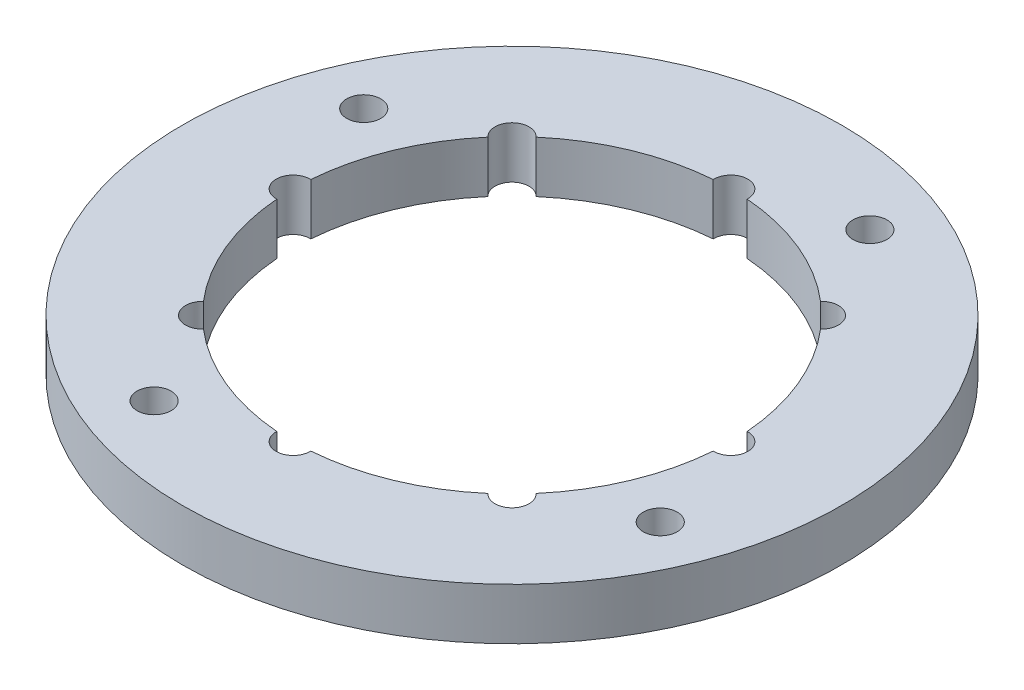
from build123d import *

# Parameters (mm, degrees)
F_1_5IN_SOCKET_R    = 40.64
F_1_5IN_SOCKET_R_2  = 2.1
BOSS_EXTRUDE1_DEPTH = 6.35


with BuildPart() as part:
    # 1.5in Socket → Boss-Extrude1 (new body)
    with BuildSketch(Plane(origin=(0, 0, 0), x_dir=(1, 0, 0), z_dir=(0, 1, 0))):
        Circle(F_1_5IN_SOCKET_R)
        with Locations((-12.927811712, -31.210498367)):
            Circle(F_1_5IN_SOCKET_R_2, mode=Mode.SUBTRACT)
        with BuildLine():
            ThreePointArc((-17.544892644, 20.506142942), (-10.327669131, 24.933198884), (-2.093920166, 26.906145294))
            ThreePointArc((-2.093920166, 26.906145294), (0, 29.083), (2.093920166, 26.906145294))
            ThreePointArc((2.093920166, 26.906145294), (10.327669131, 24.933198884), (17.544892644, 20.506142942))
            ThreePointArc((17.544892644, 20.506142942), (20.564786517, 20.564786517), (20.506142942, 17.544892644))
            ThreePointArc((20.506142942, 17.544892644), (24.933198884, 10.327669131), (26.906145294, 2.093920166))
            ThreePointArc((26.906145294, 2.093920166), (29.083, 0), (26.906145294, -2.093920166))
            ThreePointArc((26.906145294, -2.093920166), (24.933198884, -10.327669131), (20.506142942, -17.544892644))
            ThreePointArc((20.506142942, -17.544892644), (20.564786517, -20.564786517), (17.544892644, -20.506142942))
            ThreePointArc((17.544892644, -20.506142942), (10.327669131, -24.933198884), (2.093920166, -26.906145294))
            ThreePointArc((2.093920166, -26.906145294), (0, -29.083), (-2.093920166, -26.906145294))
            ThreePointArc((-2.093920166, -26.906145294), (-10.327669131, -24.933198884), (-17.544892644, -20.506142942))
            ThreePointArc((-17.544892644, -20.506142942), (-20.564786517, -20.564786517), (-20.506142942, -17.544892644))
            ThreePointArc((-20.506142942, -17.544892644), (-24.933198884, -10.327669131), (-26.906145294, -2.093920166))
            ThreePointArc((-26.906145294, -2.093920166), (-29.083, 0), (-26.906145294, 2.093920166))
            ThreePointArc((-26.906145294, 2.093920166), (-24.933198884, 10.327669131), (-20.506142942, 17.544892644))
            ThreePointArc((-20.506142942, 17.544892644), (-20.564786517, 20.564786517), (-17.544892644, 20.506142942))
        make_face(mode=Mode.SUBTRACT)
        with Locations((31.210498367, -12.927811712)):
            Circle(F_1_5IN_SOCKET_R_2, mode=Mode.SUBTRACT)
        with Locations((-31.210498367, 12.927811712)):
            Circle(F_1_5IN_SOCKET_R_2, mode=Mode.SUBTRACT)
        with Locations((12.927811712, 31.210498367)):
            Circle(F_1_5IN_SOCKET_R_2, mode=Mode.SUBTRACT)
    extrude(amount=BOSS_EXTRUDE1_DEPTH)


solid = part.part
